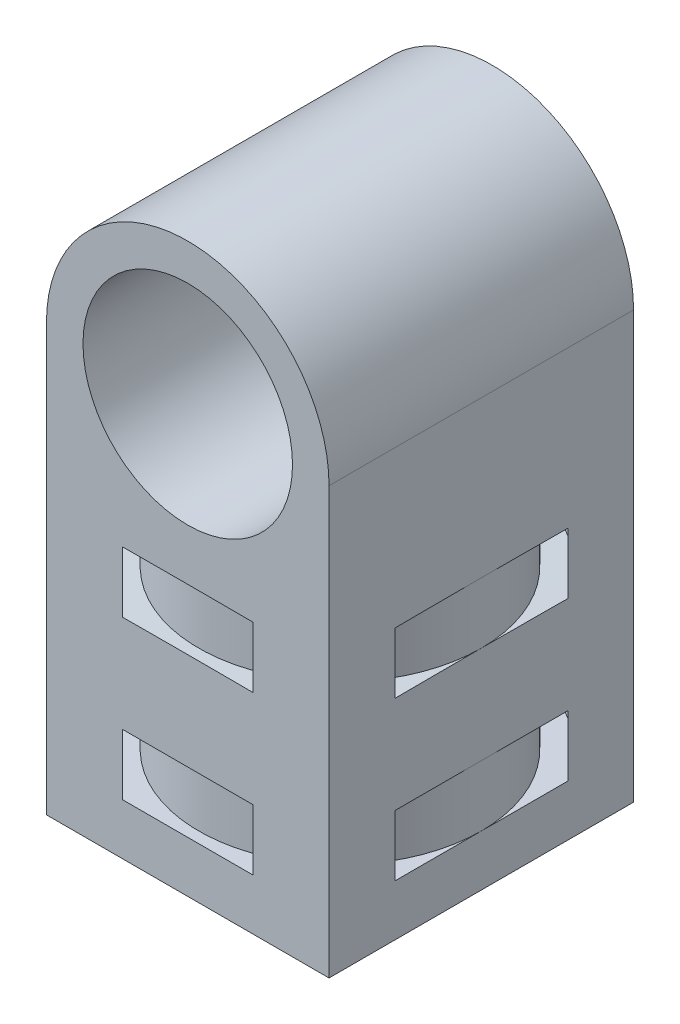
from build123d import *

# Parameters (mm, degrees)
CROQUIS1_R              = 8.6
SALIENTE_EXTRUIR1_DEPTH = 12.5
CROQUIS3_W              = 23.2
CROQUIS3_H              = 25
CROQUIS3_R              = 8.6
SALIENTE_EXTRUIR2_DEPTH = 25
CROQUIS8_W              = 2
CROQUIS8_H              = 5


with BuildPart() as part:
    # Croquis1 → Saliente-Extruir1 (new, symmetric)
    with BuildSketch(Plane.XY):
        with BuildLine():
            Line((-11.6, -10), (11.6, -10))
            Line((11.6, -10), (11.6, 0))
            ThreePointArc((11.6, 0), (0, 11.6), (-11.6, 0))
            Line((-11.6, 0), (-11.6, -10))
        make_face()
        Circle(CROQUIS1_R, mode=Mode.SUBTRACT)
    extrude(amount=SALIENTE_EXTRUIR1_DEPTH, both=True)

    # Croquis3 → Saliente-Extruir2 (add)
    with BuildSketch(Plane(origin=(0, -10, 0), x_dir=(-1, 0, 0), z_dir=(0, -1, 0))):
        Rectangle(CROQUIS3_W, CROQUIS3_H)
        Circle(CROQUIS3_R, mode=Mode.SUBTRACT)
    extrude(amount=SALIENTE_EXTRUIR2_DEPTH)

    # Croquis8 → Cortar-Revolución1 (revolve, cut)
    with BuildSketch(Plane.XY):
        Polygon((-13.599843155, -12.825047053), (-13.599843155, -17.825047053), (-11.6, -17.8), (-11.6, -12.8), align=None)
        with Locations((-12.6, -28.3)):
            Rectangle(CROQUIS8_W, CROQUIS8_H)
    revolve(axis=Axis((0, -8.6, 0), (0, -1, 0)), mode=Mode.SUBTRACT)


solid = part.part
